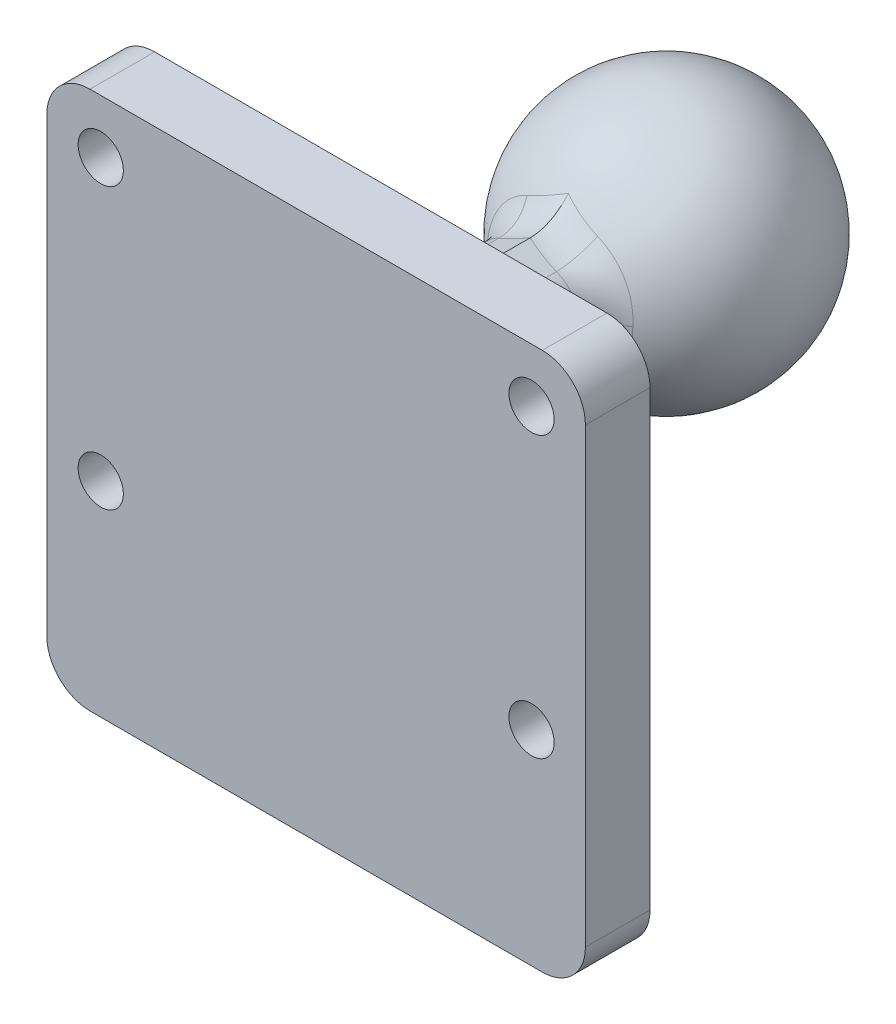
from build123d import *

# Parameters (mm, degrees)
SKETCH1_W                     = 25
SKETCH1_H                     = 25
BOSS_EXTRUDE1_DEPTH           = 3
SKETCH2_R                     = 1.05
CUT_EXTRUDE1_DEPTH            = 18.930421077
LPATTERN1_COUNT               = 2
LPATTERN1_PITCH               = 20
LPATTERN1_COUNT_DIR2          = 2
LPATTERN1_PITCH_DIR2          = 13
BOSS_EXTRUDE2_DEPTH           = 2.5
BOSS_EXTRUDE2_TAPER           = 25
BOSS_EXTRUDE2_OTHER_WAY_DEPTH = 2.5
BOSS_EXTRUDE2_OTHER_WAY_TAPER = 25
FILLET1_R                     = 2


with BuildPart() as part:
    # Sketch1 → Boss-Extrude1 (new body)
    with BuildSketch(Plane.XY):
        Rectangle(SKETCH1_W, SKETCH1_H)
    extrude(amount=BOSS_EXTRUDE1_DEPTH)

    # Sketch2 → Cut-Extrude1 (cut, through all)
    with BuildSketch(Plane.XY.offset(3)):
        with Locations((-10, 10)):
            Circle(SKETCH2_R)
    cut_extrude1 = extrude(amount=-CUT_EXTRUDE1_DEPTH, mode=Mode.SUBTRACT)

    # LPattern1: Cut-Extrude1 2 × 2
    with Locations(*[(i * LPATTERN1_PITCH, -j * LPATTERN1_PITCH_DIR2, 0) for i in range(LPATTERN1_COUNT) for j in range(LPATTERN1_COUNT_DIR2) if (i, j) != (0, 0)]):
        add(cut_extrude1, mode=Mode.SUBTRACT)

    # Sketch3 → Boss-Extrude2 (add)
    with BuildSketch(Plane(origin=(0, 0, 0), x_dir=(0, 0, -1), z_dir=(1, 0, 0))):
        with BuildLine():
            Line((-2.651442704, 6.804589408), (-3, -5.317041362))
            Line((-3, -5.317041362), (14.296074209, 0.985915074))
            ThreePointArc((14.296074209, 0.985915074), (16.22322659, 4.326114574), (13.268905771, 6.804589408))
            Line((13.268905771, 6.804589408), (-2.651442704, 6.804589408))
        make_face()
    extrude(amount=BOSS_EXTRUDE2_DEPTH, taper=BOSS_EXTRUDE2_TAPER)

    # Sketch3 → Boss-Extrude2 other way (add)
    with BuildSketch(Plane(origin=(0, 0, 0), x_dir=(0, 0, -1), z_dir=(1, 0, 0))):
        with BuildLine():
            Line((-2.651442704, 6.804589408), (-3, -5.317041362))
            Line((-3, -5.317041362), (14.296074209, 0.985915074))
            ThreePointArc((14.296074209, 0.985915074), (16.22322659, 4.326114574), (13.268905771, 6.804589408))
            Line((13.268905771, 6.804589408), (-2.651442704, 6.804589408))
        make_face()
    extrude(amount=-BOSS_EXTRUDE2_OTHER_WAY_DEPTH, taper=BOSS_EXTRUDE2_OTHER_WAY_TAPER)

    # Sketch4 → Revolve1 (revolve)
    with BuildSketch(Plane(origin=(0, 0, 0), x_dir=(0, 0, -1), z_dir=(1, 0, 0))):
        with BuildLine():
            Line((13.268905771, 9.804589408), (13.268905771, -2.195410592))
            ThreePointArc((13.268905771, -2.195410592), (19.268905771, 3.804589408), (13.268905771, 9.804589408))
        make_face()
    revolve(axis=Axis((0, -7.872570186, -13.268905771), (0, 1, 0)))

    # Fillet1
    fillet1_edges = [part.edges().sort_by_distance(p)[0] for p in [
        (-1.25, 6.221704835, 0),
        (1.25, -3.603413443, 0),
        (1.253534718, -0.295759284, -9.071788752),
        (1.253534718, 6.220056569, -7.921554169),
        (2.5, -1.330278976, -4.535353587),
        (2.5, 1.327894214, 0),
        (2.5, 5.638820262, -4.066107252),
        (2.5, 2.856394757, -7.897599886),
        (-2.5, 1.327894214, 0),
        (-2.5, -1.330278976, -4.535353587),
        (-2.5, 2.856394757, -7.897599886),
        (-2.5, 5.638820262, -4.066107252),
        (-1.253534718, -0.295759284, -9.071788752),
        (-1.25, -3.603413443, 0),
        (1.25, 6.221704835, 0),
        (-1.253534718, 6.220056569, -7.921554169),
        (-12.5, -12.5, 1.5),
        (12.5, -12.5, 1.5),
        (-12.5, 12.5, 1.5),
        (12.5, 12.5, 1.5),
    ]]
    fillet(fillet1_edges, radius=FILLET1_R)


solid = part.part
